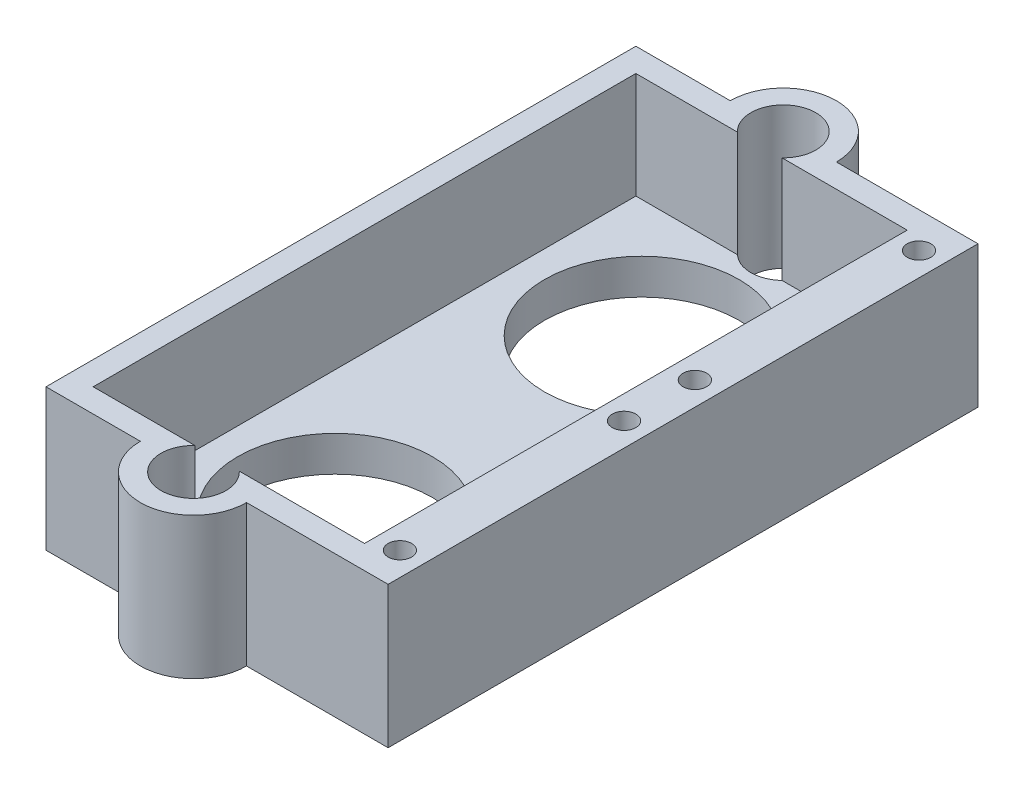
from build123d import *

# Parameters (mm, degrees)
BOSS_EXTRUDE1_DEPTH      = 2
BOSS_EXTRUDE2_DEPTH      = 1
SKETCH3_R                = 1
CUT_EXTRUDE1_DEPTH       = 1
BOSS_EXTRUDE3_DEPTH      = 2
BOSS_EXTRUDE3_DEPTH_BACK = 1
BOSS_EXTRUDE4_START      = -3
BOSS_EXTRUDE4_OUTLINE_R  = 1
BOSS_EXTRUDE4_DEPTH      = 3
SKETCH6_R                = 3.500627768
BOSS_EXTRUDE5_DEPTH      = 3
BOSS_EXTRUDE6_DEPTH      = 3
CUT_EXTRUDE2_DEPTH       = 15
FILLET1_R                = 20
FILLET2_R                = 3
FILLET3_R                = 3
SKETCH9_R                = 1
CUT_EXTRUDE3_DEPTH       = 15
CUT_EXTRUDE4_DEPTH       = 1.5
FILLET4_R                = 8
FILLET5_R                = 2
SKETCH11_W               = 110.258684369
SKETCH11_H               = 6.064888907
CUT_EXTRUDE5_DEPTH       = 38
SKETCH12_R               = 18.613151801
CUT_EXTRUDE6_DEPTH       = 29
SKETCH13_W               = 77.706478895
SKETCH13_H               = 41.021519778
CUT_EXTRUDE7_DEPTH       = 1
FILLET6_START            = -4.447684996
FILLET6_DEPTH            = 2
FILLET6_START_2          = 2.447684996
FILLET6_2_DEPTH          = 2
FILLET6_START_3          = -1
FILLET6_3_DEPTH          = 1
FILLET6_START_4          = -2.447684996
FILLET6_4_DEPTH          = 4.895369992
CUT_EXTRUDE8_DEPTH       = 37
CUT_EXTRUDE8_DEPTH_BACK  = 10
SKETCH14_W               = 81.474605317
SKETCH14_H               = 77.503756956
BOSS_EXTRUDE7_DEPTH      = 2
BOSS_EXTRUDE7_DEPTH_BACK = 1
BOSS_EXTRUDE8_DEPTH      = 8
BOSS_EXTRUDE8_DEPTH_BACK = 3
SKETCH16_W               = 2
SKETCH16_H               = 10.5
BOSS_EXTRUDE9_DEPTH      = 10.5
FILLET7_R                = 10
SKETCH18_W               = 1.521986252
SKETCH18_H               = 3
BOSS_EXTRUDE10_DEPTH     = 10.5
FILLET8_R                = 2
SKETCH19_W               = 25
SKETCH19_H               = 2
BOSS_EXTRUDE11_DEPTH     = 10.5
SKETCH20_W               = 4
SKETCH20_H               = 10
SKETCH20_R               = 1
BOSS_EXTRUDE12_DEPTH     = 5
FILLET9_R                = 2
FILLET10_R               = 2
FILLET11_R               = 2
SKETCH21_R               = 8.25
BOSS_EXTRUDE13_DEPTH     = 3
BOSS_EXTRUDE14_START     = 3
SKETCH23_W               = 4
SKETCH23_H               = 10
SKETCH23_R               = 1
BOSS_EXTRUDE14_DEPTH     = 3
SKETCH25_R               = 50.400338574
CUT_EXTRUDE9_DEPTH       = 20
BOSS_EXTRUDE15_DEPTH     = 12
SKETCH27_W               = 4
SKETCH27_H               = 50
SKETCH27_R               = 1
BOSS_EXTRUDE16_DEPTH     = 12
SKETCH28_R               = 2.5
CUT_EXTRUDE10_DEPTH      = 18
BOSS_EXTRUDE17_DEPTH     = 12
SKETCH30_R               = 2.75
CUT_EXTRUDE11_DEPTH      = 18
SKETCH31_R               = 1
CUT_EXTRUDE12_DEPTH      = 8


with BuildPart() as part:
    # Sketch1 → Boss-Extrude1 (new body)
    with BuildSketch(Plane.XY):
        with BuildLine():
            Line((14.458185053, 3.677415528), (0.579181495, 5.217954465))
            ThreePointArc((0.579181495, 5.217954465), (-5.25, 0), (0.579181495, -5.217954465))
            Line((0.579181495, -5.217954465), (14.458185053, -3.677415528))
            ThreePointArc((14.458185053, -3.677415528), (17.75, 0), (14.458185053, 3.677415528))
        make_face()
        with BuildLine():
            Line((14.292704626, 2.186571395), (0.413701068, 3.727110332))
            ThreePointArc((0.413701068, 3.727110332), (-3.75, 0), (0.413701068, -3.727110332))
            Line((0.413701068, -3.727110332), (14.292704626, -2.186571395))
            ThreePointArc((14.292704626, -2.186571395), (16.25, 0), (14.292704626, 2.186571395))
        make_face(mode=Mode.SUBTRACT)
    extrude(amount=BOSS_EXTRUDE1_DEPTH)

    # Sketch2 → Boss-Extrude2 (add)
    with BuildSketch(Plane.XY.offset(2)):
        with BuildLine():
            Line((14.458185053, 3.677415528), (0.579181495, 5.217954465))
            ThreePointArc((0.579181495, 5.217954465), (-5.25, 0), (0.579181495, -5.217954465))
            Line((0.579181495, -5.217954465), (14.458185053, -3.677415528))
            ThreePointArc((14.458185053, -3.677415528), (17.75, 0), (14.458185053, 3.677415528))
        make_face()
    extrude(amount=BOSS_EXTRUDE2_DEPTH)

    # Sketch3 → Cut-Extrude1 (cut)
    with BuildSketch(Plane.XY.offset(3)):
        Circle(SKETCH3_R)
    extrude(amount=-CUT_EXTRUDE1_DEPTH, mode=Mode.SUBTRACT)

    # Sketch4 → Boss-Extrude3 (add, two sides: drawn at the far end of the back side and taken through both)
    with BuildSketch(Plane(origin=(0, 0, 2), x_dir=(-1, 0, 0), z_dir=(0, 0, -1)).offset(-BOSS_EXTRUDE3_DEPTH_BACK)):
        with BuildLine():
            Line((-15.26072202, 2.426182253), (-7.518683274, 4.447684996))
            Line((-7.518683274, 4.447684996), (-42.518683274, 4.447684996))
            ThreePointArc((-42.518683274, 4.447684996), (-39.373695053, 3.144988221), (-38.070998278, 0))
            ThreePointArc((-38.070998278, 0), (-39.373695053, -3.144988221), (-42.518683274, -4.447684996))
            Line((-42.518683274, -4.447684996), (-7.518683274, -4.447684996))
            Line((-7.518683274, -4.447684996), (-13.862339481, -2.595687971))
            Line((-13.862339481, -2.595687971), (-16.213670101, -1.84565397))
            Line((-16.213670101, -1.84565397), (-17.166618181, 0))
            Line((-17.166618181, 0), (-15.26072202, 2.426182253))
        make_face()
        with BuildLine():
            ThreePointArc((-38.070998278, 0), (-39.373695053, 3.144988221), (-42.518683274, 4.447684996))
            Line((-42.518683274, 4.447684996), (-42.518683274, 2))
            ThreePointArc((-42.518683274, 2), (-41.104469712, 1.414213562), (-40.518683274, 0))
            ThreePointArc((-40.518683274, 0), (-41.104469712, -1.414213562), (-42.518683274, -2))
            Line((-42.518683274, -2), (-42.518683274, -4.447684996))
            ThreePointArc((-42.518683274, -4.447684996), (-39.373695053, -3.144988221), (-38.070998278, 0))
        make_face()
        with BuildLine():
            Line((-42.518683274, 2), (-42.518683274, 4.447684996))
            ThreePointArc((-42.518683274, 4.447684996), (-46.96636827, 0), (-42.518683274, -4.447684996))
            Line((-42.518683274, -4.447684996), (-42.518683274, -2))
            ThreePointArc((-42.518683274, -2), (-44.518683274, 0), (-42.518683274, 2))
        make_face()
    extrude(amount=BOSS_EXTRUDE3_DEPTH + BOSS_EXTRUDE3_DEPTH_BACK)

    # Boss-Extrude4: read off the stored shape, not the designer's step
    # Boss-Extrude4 outline → Boss-Extrude4 (add)
    with BuildSketch(Plane(origin=(0, 0, 0), x_dir=(-1, 0, 0), z_dir=(0, 0, -1)).offset(BOSS_EXTRUDE4_START)):
        with BuildLine():
            ThreePointArc((-42.518683274, -4.447684996), (-46.96636827, 0), (-42.518683274, 4.447684996))
            Line((-42.518683274, 4.447684996), (-54.290526798, 4.447684996))
            ThreePointArc((-54.290526798, 4.447684996), (-59.289068337, 5.305033813), (-63.716210719, 7.779073998))
            ThreePointArc((-63.716210719, 7.779073998), (-80, 0), (-63.716210719, -7.779073998))
            ThreePointArc((-63.716210719, -7.779073998), (-59.289068337, -5.305033813), (-54.290526798, -4.447684996))
            Line((-54.290526798, -4.447684996), (-42.518683274, -4.447684996))
        make_face()
        with Locations((-68.205771366, -4.5)):
            Circle(BOSS_EXTRUDE4_OUTLINE_R, mode=Mode.SUBTRACT)
        with Locations((-76, 0)):
            Circle(BOSS_EXTRUDE4_OUTLINE_R, mode=Mode.SUBTRACT)
        with Locations((-68.205771366, 4.5)):
            Circle(BOSS_EXTRUDE4_OUTLINE_R, mode=Mode.SUBTRACT)
    extrude(amount=BOSS_EXTRUDE4_DEPTH)

    # Sketch6 → Boss-Extrude5 (add)
    with BuildSketch(Plane(origin=(0, 0, 0), x_dir=(-1, 0, 0), z_dir=(0, 0, -1))):
        with Locations((-42.518683274, 0)):
            Circle(SKETCH6_R)
    extrude(amount=-BOSS_EXTRUDE5_DEPTH)

    # Sketch7 → Boss-Extrude6 (add)
    with BuildSketch(Plane(origin=(0, 0, 0), x_dir=(-1, 0, 0), z_dir=(0, 0, -1))):
        Polygon((-54.290526798, 4.447684996), (-94.290526798, 4.447684996), (-94.290526798, -3.552315004), (-68.73970048, -3.552315004), (-92.931542949, -17.519481766), (-88.931542949, -24.447684996), (-54.290526798, -4.447684996), align=None)
    extrude(amount=-BOSS_EXTRUDE6_DEPTH)

    # Sketch8 → Cut-Extrude2 (cut)
    with BuildSketch(Plane(origin=(0, 0, 0), x_dir=(-1, 0, 0), z_dir=(0, 0, -1))):
        Polygon((-94.290526798, 4.447684996), (-45.837456427, 4.447684996), (-68.326886593, 15.265325323), align=None)
        Polygon((-94.290526798, -3.552315004), (-68.73970048, -3.552315004), (-92.931542949, -17.519481766), align=None)
    extrude(amount=-CUT_EXTRUDE2_DEPTH, mode=Mode.SUBTRACT)

    # Fillet1
    fillet1_edges = [part.edges().sort_by_distance(p)[0] for p in [
        (54.290526798, -4.447684996, 1.5),
    ]]
    fillet(fillet1_edges, radius=FILLET1_R)

    # Fillet2
    fillet2_edges = [part.edges().sort_by_distance(p)[0] for p in [
        (94.290526798, 4.447684996, 1.5),
        (94.290526798, -3.552315004, 1.5),
        (92.931542949, -17.519481766, 1.5),
        (88.931542949, -24.447684996, 1.5),
    ]]
    fillet(fillet2_edges, radius=FILLET2_R)

    # Fillet3
    fillet3_edges = [part.edges().sort_by_distance(p)[0] for p in [
        (68.73970048, -3.552315004, 1.5),
    ]]
    fillet(fillet3_edges, radius=FILLET3_R)

    # Sketch9 → Cut-Extrude3 (cut)
    with BuildSketch(Plane(origin=(0, 0, 0), x_dir=(-1, 0, 0), z_dir=(0, 0, -1))):
        with Locations((-89.290526798, 0.447684996)):
            Circle(SKETCH9_R)
        with Locations((-79.290526798, 0.447684996)):
            Circle(SKETCH9_R)
        with Locations((-77.941161892, -13.483583381)):
            Circle(SKETCH9_R)
        with Locations((-86.60141593, -18.483583381)):
            Circle(SKETCH9_R)
    extrude(amount=-CUT_EXTRUDE3_DEPTH, mode=Mode.SUBTRACT)

    # Sketch10 → Cut-Extrude4 (cut)
    with BuildSketch(Plane(origin=(0, 0, 0), x_dir=(-1, 0, 0), z_dir=(0, 0, -1))):
        with BuildLine():
            Line((-19.05, 2.447684996), (-67.154630008, 2.447684996))
            ThreePointArc((-67.154630008, 2.447684996), (-70.616179326, -5.909234314), (-62.259260015, -2.447684996))
            Line((-62.259260015, -2.447684996), (-19.05, -2.447684996))
            Line((-19.05, -2.447684996), (-19.05, 2.447684996))
        make_face()
    extrude(amount=-CUT_EXTRUDE4_DEPTH, mode=Mode.SUBTRACT)

    # Fillet4
    fillet4_edges = [part.edges().sort_by_distance(p)[0] for p in [
        (62.259260015, -2.447684996, 0.75),
    ]]
    fillet(fillet4_edges, radius=FILLET4_R)

    # Fillet5
    fillet5_edges = [part.edges().sort_by_distance(p)[0] for p in [
        (19.05, 2.447684996, 0.75),
        (19.05, -2.447684996, 0.75),
    ]]
    fillet(fillet5_edges, radius=FILLET5_R)

    # Mirror1: part across plane


with BuildPart() as part_1:
    add(part.part)
    add(part.part.mirror(Plane(origin=(14.05, 0, 0), x_dir=(1, 0, 0), z_dir=(0, 0, 1))))

    # Sketch11 → Cut-Extrude5 (cut)
    with BuildSketch(Plane(origin=(0, 4.447684996, 0), x_dir=(1, 0, 0), z_dir=(0, 1, 0))):
        with Locations((47.771534573, -3.032444454)):
            Rectangle(SKETCH11_W, SKETCH11_H)
    extrude(amount=-CUT_EXTRUDE5_DEPTH, mode=Mode.SUBTRACT)

    # Sketch12 → Cut-Extrude6 (cut)
    with BuildSketch(Plane.XY):
        with Locations((7.534351793, 3.599902348)):
            Circle(SKETCH12_R)
    extrude(amount=CUT_EXTRUDE6_DEPTH, mode=Mode.SUBTRACT)

    # Sketch13 → Cut-Extrude7 (cut)
    with BuildSketch(Plane.XY):
        with Locations((57.903239447, -8.718962854)):
            Rectangle(SKETCH13_W, SKETCH13_H)
    extrude(amount=-CUT_EXTRUDE7_DEPTH, mode=Mode.SUBTRACT)

    # Fillet6: read off the stored shape, not the designer's step
    # Fillet6 outline → Fillet6 (add)
    with BuildSketch(Plane(origin=(0, 0, 0), x_dir=(1, 0, 0), z_dir=(0, 1, 0)).offset(FILLET6_START)):
        with BuildLine():
            Line((19.05, 1), (19.049997006, -1.45e-06))
            ThreePointArc((19.049997006, -1.45e-06), (21.172829345, 0.746793973), (23.408898944, 1))
            Line((23.408898944, 1), (19.05, 1))
        make_face()
    extrude(amount=FILLET6_DEPTH)

    # Fillet6 2 outline → Fillet6 2 (add)
    with BuildSketch(Plane(origin=(0, 0, 0), x_dir=(1, 0, 0), z_dir=(0, 1, 0)).offset(FILLET6_START_2)):
        with BuildLine():
            Line((19.05, 1), (19.049997006, -1.45e-06))
            ThreePointArc((19.049997006, -1.45e-06), (21.172829345, 0.746793973), (23.408898944, 1))
            Line((23.408898944, 1), (19.05, 1))
        make_face()
    extrude(amount=FILLET6_2_DEPTH)

    # Fillet6 3 outline → Fillet6 3 (add)
    with BuildSketch(Plane.XY.offset(FILLET6_START_3)):
        with BuildLine():
            Line((19.05, 2.447684996), (19.05, 0.447684996))
            ThreePointArc((19.05, 0.447684996), (19.635786438, 1.861898559), (21.05, 2.447684996))
            Line((21.05, 2.447684996), (19.05, 2.447684996))
        make_face()
        with BuildLine():
            ThreePointArc((21.05, -2.447684996), (19.635786438, -1.861898559), (19.05, -0.447684996))
            Line((19.05, -0.447684996), (19.05, -2.447684996))
            Line((19.05, -2.447684996), (21.05, -2.447684996))
        make_face()
    extrude(amount=FILLET6_3_DEPTH)

    # Fillet6 4 outline → Fillet6 4 (cut)
    with BuildSketch(Plane(origin=(0, 0, 0), x_dir=(1, 0, 0), z_dir=(0, 1, 0)).offset(FILLET6_START_4)):
        with BuildLine():
            ThreePointArc((23, 0.991636585), (20.973982557, 0.699029961), (19.049997006, -1.45e-06))
            Line((19.049997006, -1.45e-06), (18, -0.508538641))
            Line((18, -0.508538641), (18, -1))
            Line((18, -1), (23, -1))
            Line((23, -1), (23, 0.991636585))
        make_face()
    extrude(amount=FILLET6_4_DEPTH, mode=Mode.SUBTRACT)

    # Sketch14 → Cut-Extrude8 (cut, two sides: drawn at the far end of the back side and taken through both)
    with BuildSketch(Plane.XY.offset(-2).offset(-CUT_EXTRUDE8_DEPTH_BACK)):
        with Locations((59.787302659, 4.447684996)):
            Rectangle(SKETCH14_W, SKETCH14_H)
    extrude(amount=CUT_EXTRUDE8_DEPTH + CUT_EXTRUDE8_DEPTH_BACK, mode=Mode.SUBTRACT)

    # Sketch15 → Boss-Extrude7 (add, two sides: drawn at the far end of the back side and taken through both)
    with BuildSketch(Plane.XY.offset(-2).offset(-BOSS_EXTRUDE7_DEPTH_BACK)):
        Polygon((0, 4.349044766), (-3.638836396, 3.035019198), (-4.3304288, -1.298959868), (-2.356179656, -4.022923876), (0, -4.398909991), (0, -5.25), (-7.25, -5.25), (-7.25, 5.25), (0, 5.25), align=None)
    extrude(amount=BOSS_EXTRUDE7_DEPTH + BOSS_EXTRUDE7_DEPTH_BACK)



with BuildPart() as body_2:
    # Sketch16 → Boss-Extrude8 (new, two sides: drawn at the far end of the back side and taken through both)
    with BuildSketch(Plane.XY.offset(-BOSS_EXTRUDE8_DEPTH_BACK)):
        with Locations((-8.25, 0)):
            Rectangle(SKETCH16_W, SKETCH16_H)
    extrude(amount=BOSS_EXTRUDE8_DEPTH + BOSS_EXTRUDE8_DEPTH_BACK)

    # Sketch17 → Boss-Extrude9 (add)
    with BuildSketch(Plane.XZ.offset(5.25)):
        Polygon((-9.25, 8), (-13.25, 10), (-13.25, 8), (-9.25, 6), align=None)
    extrude(amount=-BOSS_EXTRUDE9_DEPTH)

    # Fillet7
    # the kernel refuses this fillet: 10 mm, written as the material it adds along each edge
    with BuildSketch(Plane(origin=(-9.25, -5.25, 6), x_dir=(0, 0, -1), z_dir=(0, 1, 0))) as fillet7_piece_1:
        with BuildLine():
            CenterArc((6, 10), FILLET7_R, 216.869897646, 53.130102354)
            Line((-2, 4), (-2.16, 3.88))
            ThreePointArc((-2.16, 3.88), (-1.178885438, 1.910557281), (-0.178885438, -0.089442719))
            Line((-0.178885438, -0.089442719), (0, -0.2))
            Line((0, -0.2), (6, -0.2))
            Line((6, -0.2), (6, 0))
        make_face()
    extrude(amount=10.5)


with BuildPart() as part_2:
    add(part_1.part)

    add(body_2.part)  # Boss-Extrude10 merges body 2
    # Sketch18 → Boss-Extrude10 (add)
    with BuildSketch(Plane.XZ.offset(5.25)):
        with Locations((-7.358034117, -1.5)):
            Rectangle(SKETCH18_W, SKETCH18_H)
    extrude(amount=-BOSS_EXTRUDE10_DEPTH)

    # Fillet8
    fillet8_edges = [part_2.edges().sort_by_distance(p)[0] for p in [
        (-7.25, 0, 0),
    ]]
    fillet(fillet8_edges, radius=FILLET8_R)

    # Sketch19 → Boss-Extrude11 (add)
    with BuildSketch(Plane.XZ.offset(5.25)):
        with Locations((-25.75, 9)):
            Rectangle(SKETCH19_W, SKETCH19_H)
    extrude(amount=-BOSS_EXTRUDE11_DEPTH)

    # Sketch20 → Boss-Extrude12 (add)
    with BuildSketch(Plane.XZ.offset(5.25)):
        with Locations((-40.25, 9)):
            Rectangle(SKETCH20_W, SKETCH20_H)
        with Locations(Location((-40.25, 6, 0), (0, 0, 270))):
            Circle(SKETCH20_R, mode=Mode.SUBTRACT)
        with Locations(Location((-40.25, 12, 0), (0, 0, 270))):
            Circle(SKETCH20_R, mode=Mode.SUBTRACT)
    extrude(amount=-BOSS_EXTRUDE12_DEPTH)

    # Fillet9
    fillet9_edges = [part_2.edges().sort_by_distance(p)[0] for p in [
        (-38.25, -2.75, 10),
        (-38.25, -2.75, 8),
    ]]
    fillet(fillet9_edges, radius=FILLET9_R)

    # Fillet10
    fillet10_edges = [part_2.edges().sort_by_distance(p)[0] for p in [
        (-7.25, 0, 8),
    ]]
    fillet(fillet10_edges, radius=FILLET10_R - 0.0001)  # a hair under: the kernel refuses the full size

    # Fillet11
    fillet11_edges = [part_2.edges().sort_by_distance(p)[0] for p in [
        (19.05, 4.447684996, -1.5),
        (19.05, -4.447684996, -1.5),
    ]]
    fillet(fillet11_edges, radius=FILLET11_R - 0.0001)  # a hair under: the kernel refuses the full size



with BuildPart() as body_2_2:
    # Sketch21 → Boss-Extrude13 (new body)
    with BuildSketch(Plane.XZ.offset(5.25)):
        Polygon((-38.25, 14), (-38.25, 34), (-63.25, 34), (-63.25, 9), (-63.25, -16), (-38.25, -16), (-38.25, 4), (-42.25, 4), (-42.25, 14), align=None)
        with Locations(Location((-50.75, -4, 0), (0, 0, 270))):
            Circle(SKETCH21_R, mode=Mode.SUBTRACT)
        with Locations(Location((-50.75, 22, 0), (0, 0, 270))):
            Circle(SKETCH21_R, mode=Mode.SUBTRACT)
    extrude(amount=BOSS_EXTRUDE13_DEPTH)


with BuildPart() as part_3:
    add(part_2.part)

    add(body_2_2.part)  # Boss-Extrude14 merges body 2 2
    # Sketch23 → Boss-Extrude14 (add)
    with BuildSketch(Plane.XZ.offset(5.25).offset(BOSS_EXTRUDE14_START)):
        with Locations((-40.25, 9)):
            Rectangle(SKETCH23_W, SKETCH23_H)
        with Locations(Location((-40.25, 6, 0), (0, 0, 270))):
            Circle(SKETCH23_R, mode=Mode.SUBTRACT)
        with Locations(Location((-40.25, 12, 0), (0, 0, 270))):
            Circle(SKETCH23_R, mode=Mode.SUBTRACT)
    extrude(amount=-BOSS_EXTRUDE14_DEPTH)

    # Sketch25 → Cut-Extrude9 (cut)
    with BuildSketch(Plane(origin=(0, -5.25, 0), x_dir=(1, 0, 0), z_dir=(0, 1, 0))):
        with Locations((-22.018232387, -10)):
            Circle(SKETCH25_R)
    extrude(amount=CUT_EXTRUDE9_DEPTH, mode=Mode.SUBTRACT)

    # Sketch26 → Boss-Extrude15 (add)
    with BuildSketch(Plane.XZ.offset(8.25)):
        Polygon((-38.25, 34), (-63.25, 34), (-63.25, -16), (-38.25, -16), (-38.25, -14), (-61.25, -14), (-61.25, 32), (-38.25, 32), align=None)
    extrude(amount=-BOSS_EXTRUDE15_DEPTH)

    # Sketch27 → Boss-Extrude16 (add)
    with BuildSketch(Plane.XZ.offset(8.25)):
        with Locations((-36.25, 9)):
            Rectangle(SKETCH27_W, SKETCH27_H)
        with Locations(Location((-36.25, 6, 0), (0, 0, 270))):
            Circle(SKETCH27_R, mode=Mode.SUBTRACT)
        with Locations(Location((-36.25, 12, 0), (0, 0, 270))):
            Circle(SKETCH27_R, mode=Mode.SUBTRACT)
    extrude(amount=-BOSS_EXTRUDE16_DEPTH)

    # Sketch28 → Cut-Extrude10 (cut)
    with BuildSketch(Plane.XZ.offset(8.25)):
        with Locations((-50.75, -16)):
            Circle(SKETCH28_R)
        with Locations((-50.75, 34)):
            Circle(SKETCH28_R)
    extrude(amount=-CUT_EXTRUDE10_DEPTH, mode=Mode.SUBTRACT)

    # Sketch29 → Boss-Extrude17 (add)
    with BuildSketch(Plane.XZ.offset(8.25)):
        with BuildLine():
            Line((-55.239729053, -15.696136494), (-53.176562378, -15.398506004))
            ThreePointArc((-53.176562378, -15.398506004), (-50.75, -18.5), (-48.323437622, -15.398506004))
            Line((-48.323437622, -15.398506004), (-46.290380625, -15.398506004))
            ThreePointArc((-46.290380625, -15.398506004), (-50.600425185, -20.497513466), (-55.239729053, -15.696136494))
        make_face()
        with BuildLine():
            Line((-55.239729053, 33.696136494), (-53.231464682, 33.696136494))
            ThreePointArc((-53.231464682, 33.696136494), (-50.75, 36.5), (-48.268535318, 33.696136494))
            Line((-48.268535318, 33.696136494), (-46.283363572, 33.453045689))
            ThreePointArc((-46.283363572, 33.453045689), (-50.627907403, 38.498343406), (-55.239729053, 33.696136494))
        make_face()
    extrude(amount=-BOSS_EXTRUDE17_DEPTH)

    # Sketch30 → Cut-Extrude11 (cut)
    with BuildSketch(Plane(origin=(0, 3.75, 0), x_dir=(1, 0, 0), z_dir=(0, 1, 0))):
        with Locations(Location((-50.75, 16, 0), (0, 0, 313.341758227))):
            Circle(SKETCH30_R)
        with Locations(Location((-50.75, -34, 0), (0, 0, 133.341758227))):
            Circle(SKETCH30_R)
    extrude(amount=-CUT_EXTRUDE11_DEPTH, mode=Mode.SUBTRACT)

    # Sketch31 → Cut-Extrude12 (cut)
    with BuildSketch(Plane(origin=(0, 3.75, 0), x_dir=(1, 0, 0), z_dir=(0, 1, 0))):
        with Locations(Location((-36.25, -31, 0), (0, 0, 270))):
            Circle(SKETCH31_R)
        with Locations(Location((-36.25, 13, 0), (0, 0, 270))):
            Circle(SKETCH31_R)
    extrude(amount=-CUT_EXTRUDE12_DEPTH, mode=Mode.SUBTRACT)


solid = part_3.part
